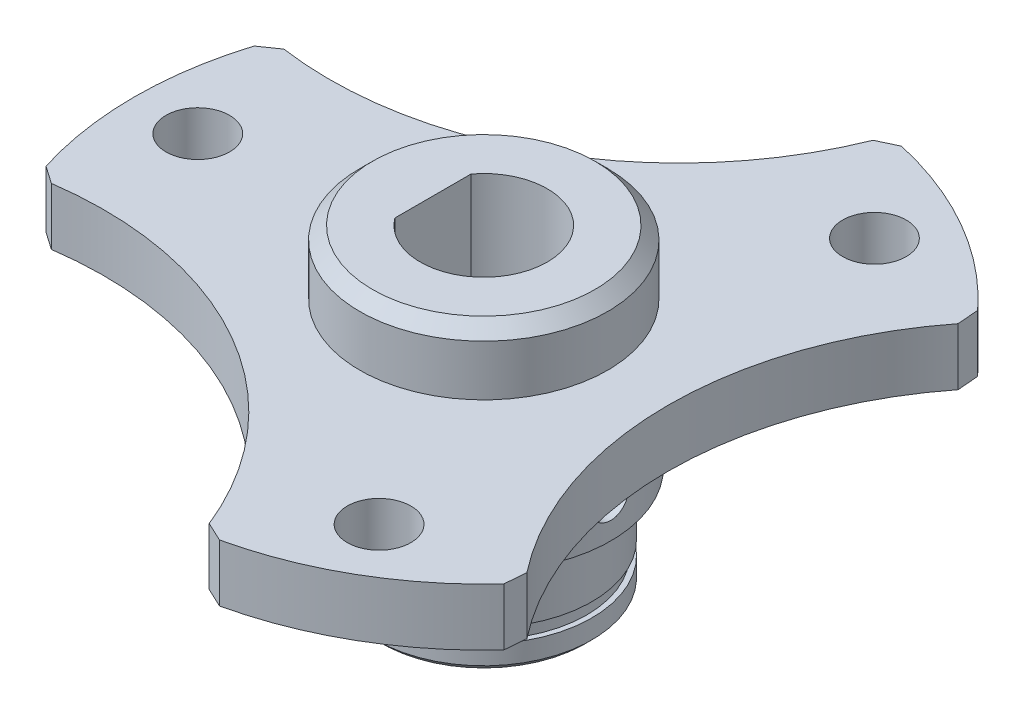
from build123d import *
from build123d.topology import SkipClean

# Parameters (mm, degrees)
SKETCH_1_R               = 27.5
EXTRUDE_1_DEPTH          = 4.5
SKETCH_2_R               = 9.75
EXTRUDE_2_DEPTH          = 30.8
CUT_EXTRUDE_1_DEPTH      = 28
SKETCH_5_R               = 10
EXTRUDE_3_DEPTH          = 7
SKETCH_6_R               = 8.5
EXTRUDE_4_DEPTH          = 8
SKETCH_11_R              = 2.5
CUT_EXTRUDE_3_DEPTH      = 50.609878049
PATTERN_CIRCULAR_1_COUNT = 6
SKETCH_12_R              = 13.008113322
CUT_EXTRUDE_4_DEPTH      = 25.8
CHAMFER_2_SIZE           = 1
SKETCH_13_W              = 0.4
SKETCH_13_H              = 1.1
CHAMFER_3_SIZE           = 0.5
CUT_EXTRUDE_5_DEPTH      = 46.964660338
SKETCH_15_R              = 1.6
CUT_EXTRUDE_6_DEPTH      = 25
HOLE_WIZARD_M3_1_D       = 2.5
SKETCH_18_R              = 27.5
CUT_EXTRUDE_7_DEPTH      = 44.505746792
PATTERN_CIRCULAR_2_COUNT = 3
PATTERN_CIRCULAR_2_ANGLE = 240
SKETCH_19_R              = 5
CUT_EXTRUDE_8_DEPTH      = 1


with BuildPart() as part:
    # 草图1 → 凸台-拉伸1 (new body)
    with BuildSketch(Plane(origin=(0, 0, 0), x_dir=(1, 0, 0), z_dir=(0, 1, 0))):
        with Locations(Location((0, 0, 0), (0, 0, 270))):
            Circle(SKETCH_1_R)
    extrude(amount=EXTRUDE_1_DEPTH)

    # 草图2 → 凸台-拉伸2 (add)
    with BuildSketch(Plane(origin=(0, 4.5, 0), x_dir=(1, 0, 0), z_dir=(0, 1, 0))):
        with Locations(Location((0, 0, 0), (0, 0, 90))):
            Circle(SKETCH_2_R)
    extrude(amount=EXTRUDE_2_DEPTH)

    # 草图4 → 切除-拉伸1 (cut)
    with BuildSketch(Plane(origin=(0, 35.3, 0), x_dir=(1, 0, 0), z_dir=(0, 1, 0))):
        with BuildLine():
            Line((-4, 3), (-4, -3))
            ThreePointArc((-4, -3), (5, 0), (-4, 3))
        make_face()
    extrude(amount=-CUT_EXTRUDE_1_DEPTH, mode=Mode.SUBTRACT)

    # 草图5 → 凸台-拉伸3 (add)
    with BuildSketch(Plane.XZ):
        with Locations(Location((0, 0, 0), (0, 0, 90))):
            Circle(SKETCH_5_R)
    extrude(amount=EXTRUDE_3_DEPTH)

    # 草图6 → 凸台-拉伸4 (add)
    with BuildSketch(Plane.XZ.offset(7)):
        with Locations(Location((0, 0, 0), (0, 0, 270))):
            Circle(SKETCH_6_R)
    extrude(amount=EXTRUDE_4_DEPTH)

    # 草图11 → 切除-拉伸3 (cut, through all)
    with BuildSketch(Plane(origin=(0, 4.5, 0), x_dir=(1, 0, 0), z_dir=(0, 1, 0))):
        with Locations(Location((-22.5, 0, 0), (0, 0, 270))):
            Circle(SKETCH_11_R)
    cut_extrude_3 = extrude(amount=-CUT_EXTRUDE_3_DEPTH, mode=Mode.SUBTRACT)

    # 阵列(圆周)1: 切除-拉伸3 ×6 about axis
    pattern_circular_1_axis = Axis((0, 0, 0), (0, 1, 0))
    for i in range(1, PATTERN_CIRCULAR_1_COUNT):
        add(cut_extrude_3.rotate(pattern_circular_1_axis, i * 360 / PATTERN_CIRCULAR_1_COUNT), mode=Mode.SUBTRACT)

    # 草图12 → 切除-拉伸4 (cut)
    with BuildSketch(Plane(origin=(0, 35.3, 0), x_dir=(1, 0, 0), z_dir=(0, 1, 0))):
        Circle(SKETCH_12_R)
    extrude(amount=-CUT_EXTRUDE_4_DEPTH, mode=Mode.SUBTRACT)

    # 倒角2
    chamfer_2_edges = [part.edges().sort_by_distance(p)[0] for p in [
        (0, 9.5, 9.75),
    ]]
    chamfer(chamfer_2_edges, length=CHAMFER_2_SIZE)

    # 草图13 → 切除-旋转1 (revolve, cut)
    with BuildSketch(Plane.XY, mode=Mode.PRIVATE) as cut_revolve_1_sk:
        with Locations((-8.3, -12.45)):
            Rectangle(SKETCH_13_W, SKETCH_13_H)
    revolve(cut_revolve_1_sk.sketch.rotate(Axis((0, 20.99290486, 0), (0, -1, 0)), 270), axis=Axis((0, 20.99290486, 0), (0, -1, 0)), mode=Mode.SUBTRACT)

    # 倒角3
    chamfer_3_edges = [part.edges().sort_by_distance(p)[0] for p in [
        (0, -15, 8.5),
    ]]
    chamfer(chamfer_3_edges, length=CHAMFER_3_SIZE)

    # 草图14 → 切除-拉伸5 (cut, through all)
    with BuildSketch(Plane.XZ.offset(15)):
        with BuildLine():
            Line((-4, -3), (-4, 3))
            ThreePointArc((-4, 3), (5, 0), (-4, -3))
        make_face()
    extrude(amount=-CUT_EXTRUDE_5_DEPTH, mode=Mode.SUBTRACT)

    # 草图15 → 切除-拉伸6 (cut)
    with BuildSketch(Plane(origin=(0, 0, 0), x_dir=(0, 0, -1), z_dir=(1, 0, 0))):
        with Locations(Location((0, -4, 0), (0, 0, 180))):
            Circle(SKETCH_15_R)
    extrude(amount=CUT_EXTRUDE_6_DEPTH, mode=Mode.SUBTRACT)

    # M3 螺纹孔1 (through all)
    with Locations(Plane(origin=(-4, 0, 0), x_dir=(0, 0, -1), z_dir=(1, 0, 0))):
        with Locations((0, -4)):
            Hole(HOLE_WIZARD_M3_1_D / 2)

    # 草图18 → 切除-拉伸7 (cut, through all)
    with BuildSketch(Plane(origin=(0, 4.5, 0), x_dir=(1, 0, 0), z_dir=(0, 1, 0))):
        with Locations((42, 0)):
            Circle(SKETCH_18_R)
    cut_extrude_7 = extrude(amount=-CUT_EXTRUDE_7_DEPTH, mode=Mode.SUBTRACT)

    # 阵列(圆周)2: 切除-拉伸7 ×3 about axis
    pattern_circular_2_axis = Axis((0, 0, 0), (0, 1, 0))
    for i in range(1, PATTERN_CIRCULAR_2_COUNT):
        add(cut_extrude_7.rotate(pattern_circular_2_axis, i * PATTERN_CIRCULAR_2_ANGLE / (PATTERN_CIRCULAR_2_COUNT - 1)), mode=Mode.SUBTRACT)

    # 倒角4
    # the kernel refuses this chamfer: 1.21981355, 1 mm, written as the material it takes off along each edge
    with BuildSketch(Plane(origin=(21, 7.559330204, 17.755280905), x_dir=(-0.6313868632849613, 0, -0.7754680063491838), z_dir=(0, -1, 0)), Plane(origin=(4.876524315, 7.559330204, -27.064173932), x_dir=(-0.3558815616779696, 0, 0.9345310663951465), z_dir=(0, -1, 0)), Plane(origin=(-25.876524315, 7.559330204, 9.308893027), x_dir=(0.9872684249629431, 0, -0.15906306004597578), z_dir=(0, -1, 0))) as chamfer_4_piece_1:
        with BuildLine():
            Line((1.019056312, 0), (-0.193408604, -1.168344991))
            ThreePointArc((-0.193408604, -1.168344991), (-0.106182465, -0.602433867), (0, 0))
            ThreePointArc((0, 0), (0.527109428, -0.00471513), (1.019056312, 0))
        make_face()
    extrude(amount=10.618660408, mode=Mode.SUBTRACT)
    with BuildSketch(Plane(origin=(21, 7.559330204, -17.755280905), x_dir=(-0.6313868632849639, 0, 0.7754680063491817), z_dir=(0, -1, 0))) as chamfer_4_piece_2:
        with BuildLine():
            Line((1.019056312, 0), (-0.193408604, 1.168344991))
            ThreePointArc((-0.193408604, 1.168344991), (-0.106182465, 0.602433867), (0, 0))
            ThreePointArc((0, 0), (0.527109428, 0.00471513), (1.019056312, 0))
        make_face()
    extrude(amount=10.618660408, mode=Mode.SUBTRACT)
    with BuildSketch(Plane(origin=(-25.876524315, 7.559330204, -9.308893027), x_dir=(-0.31816612737533284, 0, 0.9480349758268328), z_dir=(0, -1, 0)), Plane(origin=(4.876524315, 7.559330204, 27.064173932), x_dir=(0.9801054364298685, 0, -0.1984775389826691), z_dir=(0, -1, 0))) as chamfer_4_piece_3:
        with BuildLine():
            Line((1.18424529, 0), (-0.166430267, -1.005373928))
            ThreePointArc((-0.166430267, -1.005373928), (-0.08143465, -0.520802246), (0, 0))
            ThreePointArc((0, 0), (0.611686784, 0.006368493), (1.18424529, 0))
        make_face()
    extrude(amount=10.618660408, mode=Mode.SUBTRACT)

    # 草图19 → 切除-拉伸8 (cut)
    with SkipClean():  # the faces are left unmerged after this step: merging them gives an invalid solid
        with BuildSketch(Plane.XZ.offset(15)):
            with Locations(Location((0, 0, 0), (0, 0, 143.130102354))):
                Circle(SKETCH_19_R)
        extrude(amount=-CUT_EXTRUDE_8_DEPTH, mode=Mode.SUBTRACT)


solid = part.part
